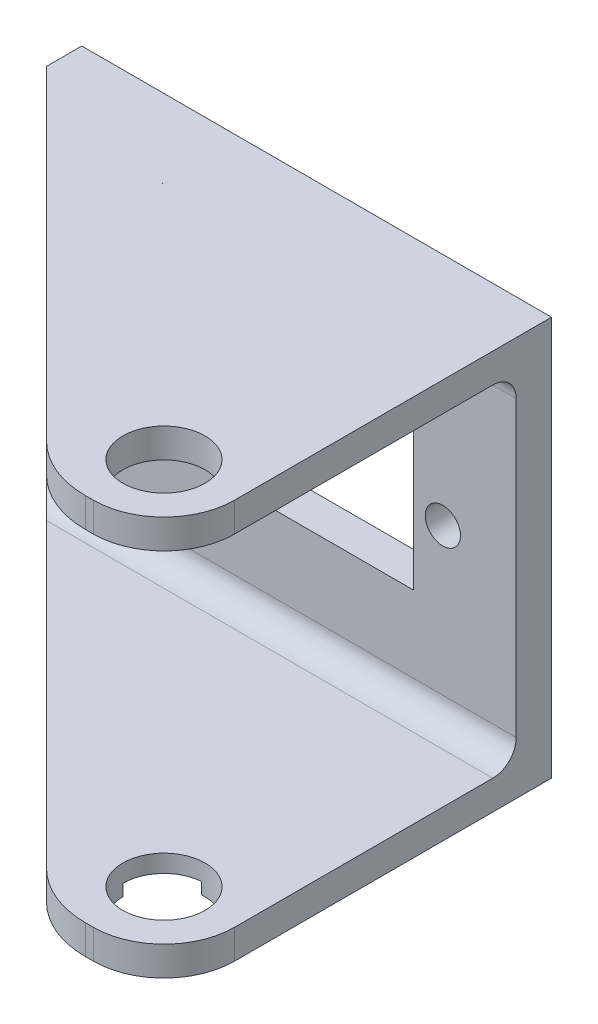
from build123d import *

# Parameters (mm, degrees)
ESBO_O1_W                  = 40
ESBO_O1_H                  = 34
ESBO_O1_R                  = 1.5
ESBO_O1_W_2                = 22.5
ESBO_O1_H_2                = 12
RESSALTO_EXTRUS_O1_DEPTH   = 3
ESBO_O2_W                  = 40
ESBO_O2_H                  = 2.5
RESSALTO_EXTRUS_O2_DEPTH   = 30
CORTE_EXTRUS_O1_DEPTH      = 53.282720471
CORTE_EXTRUS_O1_DEPTH_BACK = 53.282720471
ESBO_O3_R                  = 3.5
FILETE1_R                  = 6
FILETE2_R                  = 2
CORTE_EXTRUS_O2_DEPTH      = 1
FILETE4_R                  = 8


with BuildPart() as part:
    # Esboço1 → Ressalto-extrusão1 (new body)
    with BuildSketch(Plane.XY):
        with Locations((-2.101648352, 0.459478022)):
            Rectangle(ESBO_O1_W, ESBO_O1_H)
        with Locations((11.648351648, 0.459478022)):
            Circle(ESBO_O1_R, mode=Mode.SUBTRACT)
        with Locations((-15.851648352, 0.459478022)):
            Circle(ESBO_O1_R, mode=Mode.SUBTRACT)
        with Locations((-2.101648352, 0.459478022)):
            Rectangle(ESBO_O1_W_2, ESBO_O1_H_2, mode=Mode.SUBTRACT)
    extrude(amount=RESSALTO_EXTRUS_O1_DEPTH)

    # Esboço2 → Ressalto-extrusão2 (add)
    with BuildSketch(Plane.XY.offset(3)):
        with Locations((-2.101648352, 16.209478022)):
            Rectangle(ESBO_O2_W, ESBO_O2_H)
        with Locations((-2.101648352, -15.290521978)):
            Rectangle(ESBO_O2_W, ESBO_O2_H)
    extrude(amount=RESSALTO_EXTRUS_O2_DEPTH)

    # Esboço3 → Corte-extrusão1 (cut, two sides: drawn at the far end of the back side and taken through both)
    with BuildSketch(Plane.XZ.offset(16.540521978).offset(-CORTE_EXTRUS_O1_DEPTH_BACK)):
        with Locations((11.898351648, 27)):
            Circle(ESBO_O3_R)
        Polygon((-22.101648352, 3), (7.898351648, 33), (-22.101648352, 33), align=None)
    extrude(amount=CORTE_EXTRUS_O1_DEPTH + CORTE_EXTRUS_O1_DEPTH_BACK, mode=Mode.SUBTRACT)

    # Filete1
    filete1_edges = [part.edges().sort_by_distance(p)[0] for p in [
        (17.898351648, 16.209478022, 33),
        (17.898351648, -15.290521978, 33),
    ]]
    fillet(filete1_edges, radius=FILETE1_R)

    # Filete2
    filete2_edges = [part.edges().sort_by_distance(p)[0] for p in [
        (-2.101648352, -14.040521978, 3),
        (-2.101648352, 14.959478022, 3),
    ]]
    fillet(filete2_edges, radius=FILETE2_R)

    # Esboço4 → Corte-extrusão2 (cut)
    with BuildSketch(Plane.XZ.offset(16.540521978)):
        Polygon((8.398351648, 27), (-2.157894846, 16.343280995), (1.213419281, 13.003751923), (11.621565934, 23.510961498), align=None)
    extrude(amount=-CORTE_EXTRUS_O2_DEPTH, mode=Mode.SUBTRACT)

    # Filete4
    filete4_edges = [part.edges().sort_by_distance(p)[0] for p in [
        (7.898351648, -15.290521978, 33),
        (7.898351648, 16.209478022, 33),
    ]]
    fillet(filete4_edges, radius=FILETE4_R)


solid = part.part
